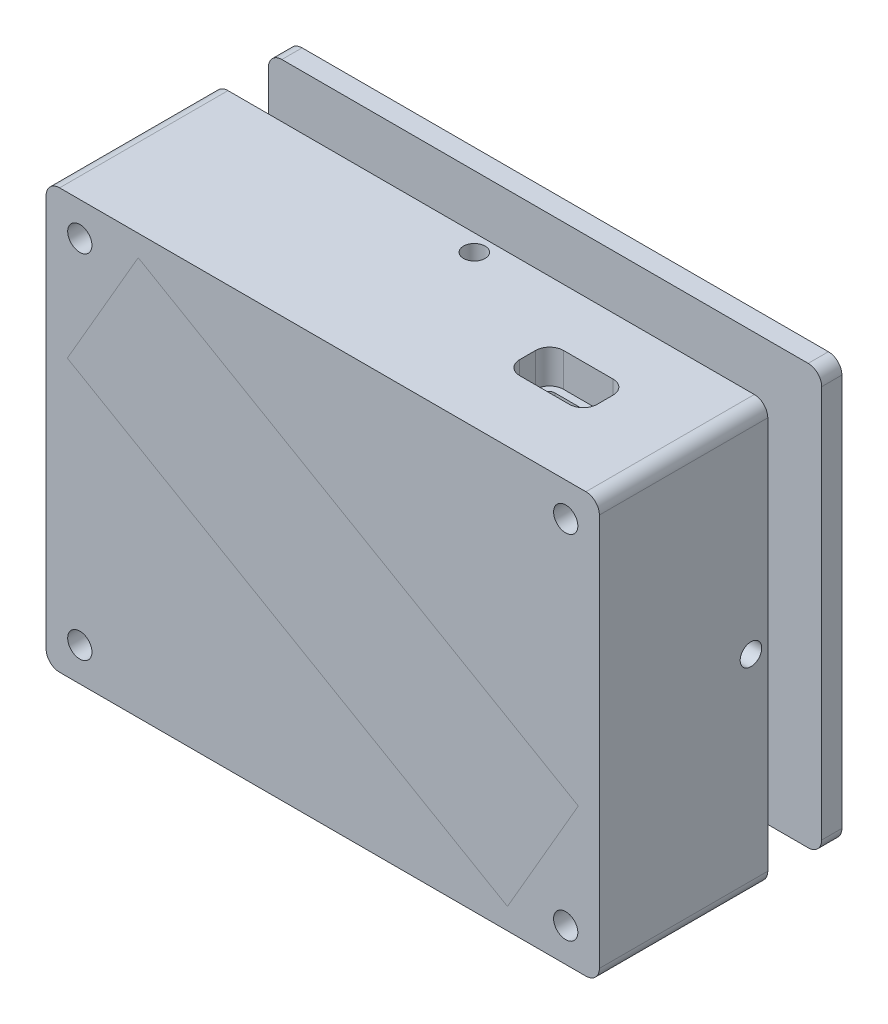
from build123d import *

# Parameters (mm, degrees)
SKETCH1_W                = 70
SKETCH1_H                = 50
BOSS_EXTRUDE1_DEPTH      = 2
BOSS_EXTRUDE2_DEPTH      = 21
EXTRUDE_THIN1_DEPTH      = 10
EXTRUDE_THIN1_DEPTH_BACK = 23
SKETCH3_W                = 82.141201594
SKETCH3_H                = 62.29
SKETCH3_W_2              = 76.141201594
SKETCH3_H_2              = 56.29
SKETCH4_W                = 76.141201594
SKETCH4_H                = 56.29
BOSS_EXTRUDE3_DEPTH      = 6
FILLET1_R                = 2
BOSS_EXTRUDE4_DEPTH      = 3
BOSS_EXTRUDE8_DEPTH      = 10
CUT_EXTRUDE1_DEPTH       = 8
CUT_EXTRUDE2_DEPTH       = 8
EXTRUDE_THIN2_DEPTH      = 6
BOSS_EXTRUDE9_START      = 2
BOSS_EXTRUDE9_DEPTH      = 1
FILLET2_R                = 3
SKETCH11_R               = 1.8
CUT_EXTRUDE3_DEPTH       = 5
CUT_EXTRUDE4_DEPTH       = 88.160559078
CUT_EXTRUDE4_DEPTH_BACK  = 88.160559078
SKETCH12_R               = 1.6
CUT_EXTRUDE5_DEPTH       = 92.040453046
CUT_EXTRUDE5_DEPTH_BACK  = 92.040453046
SKETCH13_R               = 1.6


with BuildPart() as part:
    # Sketch1 → Boss-Extrude1 (new body)
    with BuildSketch(Plane.XY):
        with Locations((-17.311659193, -1.674887892)):
            Rectangle(SKETCH1_W, SKETCH1_H)
    extrude(amount=BOSS_EXTRUDE1_DEPTH)

    # Sketch2 → Boss-Extrude2 (add)
    with BuildSketch(Plane.XY.offset(2)):
        Polygon((-42.790623702, 27.325112108), (-53.311659193, 9.150739706), (12.029536823, -28.674887892), (22.550572314, -10.500515491), align=None)
    extrude(amount=BOSS_EXTRUDE2_DEPTH)


with BuildPart() as body_2:
    # Sketch3 → Extrude-Thin1 (new, two sides: drawn at the far end of the back side and taken through both)
    with BuildSketch(Plane(origin=(0, 0, 0), x_dir=(-1, 0, 0), z_dir=(0, 0, -1)).offset(-EXTRUDE_THIN1_DEPTH_BACK)):
        with Locations((15.391058396, -0.669887892)):
            Rectangle(SKETCH3_W, SKETCH3_H)
        with Locations((15.391058396, -0.669887892)):
            Rectangle(SKETCH3_W_2, SKETCH3_H_2, mode=Mode.SUBTRACT)
    extrude(amount=EXTRUDE_THIN1_DEPTH + EXTRUDE_THIN1_DEPTH_BACK)

    # Sketch4 → Boss-Extrude3 (add)
    with BuildSketch(Plane.XY.offset(23)):
        with Locations((-15.391058396, -0.669887892)):
            Rectangle(SKETCH4_W, SKETCH4_H)
        Polygon((-42.790623702, 27.325112108), (-53.311659193, 9.150739706), (12.029536823, -28.674887892), (22.550572314, -10.500515491), align=None, mode=Mode.SUBTRACT)
    extrude(amount=-BOSS_EXTRUDE3_DEPTH)

    # Fillet1
    fillet1_edges = [body_2.edges().sort_by_distance(p)[0] for p in [
        (-56.461659193, 30.475112108, 6.5),
        (-56.461659193, -31.814887892, 6.5),
        (25.679542401, -31.814887892, 6.5),
        (25.679542401, 30.475112108, 6.5),
    ]]
    fillet(fillet1_edges, radius=FILLET1_R)

    # Sketch6 → Boss-Extrude8 (add)
    with BuildSketch(Plane(origin=(0, 0, 17), x_dir=(-1, 0, 0), z_dir=(0, 0, -1))):
        Polygon((-16.679542401, 27.475112108), (-22.679542401, 22.532519231), (-22.679542401, 27.475112108), align=None)
        Polygon((42.790623702, 27.325112108), (53.311659193, 9.150739706), (53.461659193, 27.475112108), (42.790623702, 27.475112108), align=None)
        Polygon((-12.029536823, -28.674887892), (-22.550572314, -10.500515491), (-22.679542401, -10.500515491), (-22.679542401, -28.814887892), (53.461659193, -28.814887892), (53.461659193, -25.814887892), (-7.089081569, -25.814887892), align=None)
    extrude(amount=BOSS_EXTRUDE8_DEPTH)

    # Sketch7 → Cut-Extrude1 (cut)
    with BuildSketch(Plane(origin=(0, 0, -10), x_dir=(-1, 0, 0), z_dir=(0, 0, -1))):
        Polygon((-28.614884021, 33.287753378), (-28.614884021, -37.390774311), (75.821884566, -37.390774311), (71.624058107, 45.166479381), align=None)
    extrude(amount=-CUT_EXTRUDE1_DEPTH, mode=Mode.SUBTRACT)

    # Sketch8 → Cut-Extrude2 (cut)
    with BuildSketch(Plane(origin=(0, 30.475112108, 0), x_dir=(1, 0, 0), z_dir=(0, 1, 0))):
        with BuildLine():
            Line((1.779542401, -8.574068331), (1.779542401, -10.925931669))
            ThreePointArc((1.779542401, -10.925931669), (2.38702295, -12.392519451), (3.853610732, -13))
            Line((3.853610732, -13), (11.20547407, -13))
            ThreePointArc((11.20547407, -13), (12.672061852, -12.392519451), (13.279542401, -10.925931669))
            Line((13.279542401, -10.925931669), (13.279542401, -8.574068331))
            ThreePointArc((13.279542401, -8.574068331), (12.672061852, -7.107480549), (11.20547407, -6.5))
            Line((11.20547407, -6.5), (3.853610732, -6.5))
            ThreePointArc((3.853610732, -6.5), (2.38702295, -7.107480549), (1.779542401, -8.574068331))
        make_face()
    extrude(amount=-CUT_EXTRUDE2_DEPTH, mode=Mode.SUBTRACT)

    # Sketch8<2> → Extrude-Thin2 (add)
    with BuildSketch(Plane(origin=(0, 30.475112108, 0), x_dir=(1, 0, 0), z_dir=(0, 1, 0))):
        with BuildLine():
            Line((-0.220457599, -8.574068331), (-0.220457599, -10.925931669))
            ThreePointArc((-0.220457599, -10.925931669), (0.972809388, -13.806733013), (3.853610732, -15))
            Line((3.853610732, -15), (11.20547407, -15))
            ThreePointArc((11.20547407, -15), (14.086275414, -13.806733013), (15.279542401, -10.925931669))
            Line((15.279542401, -10.925931669), (15.279542401, -8.574068331))
            ThreePointArc((15.279542401, -8.574068331), (14.086275414, -5.693266987), (11.20547407, -4.5))
            Line((11.20547407, -4.5), (3.853610732, -4.5))
            ThreePointArc((3.853610732, -4.5), (0.972809388, -5.693266987), (-0.220457599, -8.574068331))
        make_face()
        with BuildLine():
            Line((1.779542401, -8.574068331), (1.779542401, -10.925931669))
            ThreePointArc((1.779542401, -10.925931669), (2.38702295, -12.392519451), (3.853610732, -13))
            Line((3.853610732, -13), (11.20547407, -13))
            ThreePointArc((11.20547407, -13), (12.672061852, -12.392519451), (13.279542401, -10.925931669))
            Line((13.279542401, -10.925931669), (13.279542401, -8.574068331))
            ThreePointArc((13.279542401, -8.574068331), (12.672061852, -7.107480549), (11.20547407, -6.5))
            Line((11.20547407, -6.5), (3.853610732, -6.5))
            ThreePointArc((3.853610732, -6.5), (2.38702295, -7.107480549), (1.779542401, -8.574068331))
        make_face(mode=Mode.SUBTRACT)
    extrude(amount=-EXTRUDE_THIN2_DEPTH)

    # Sketch10 → Boss-Extrude9 (add)
    with BuildSketch(Plane.XZ.offset(-27.475112108).offset(BOSS_EXTRUDE9_START)):
        with BuildLine():
            Line((1.779542401, 8.574068331), (1.779542401, 10.925931669))
            ThreePointArc((1.779542401, 10.925931669), (2.38702295, 12.392519451), (3.853610732, 13))
            Line((3.853610732, 13), (11.20547407, 13))
            ThreePointArc((11.20547407, 13), (12.672061852, 12.392519451), (13.279542401, 10.925931669))
            Line((13.279542401, 10.925931669), (13.279542401, 8.574068331))
            ThreePointArc((13.279542401, 8.574068331), (12.672061852, 7.107480549), (11.20547407, 6.5))
            Line((11.20547407, 6.5), (3.853610732, 6.5))
            ThreePointArc((3.853610732, 6.5), (2.38702295, 7.107480549), (1.779542401, 8.574068331))
        make_face()
        with BuildLine():
            Line((3.679542401, 11.9), (11.379542401, 11.9))
            ThreePointArc((11.379542401, 11.9), (12.086649182, 11.607106781), (12.379542401, 10.9))
            Line((12.379542401, 10.9), (12.379542401, 8.6))
            ThreePointArc((12.379542401, 8.6), (12.086649182, 7.892893219), (11.379542401, 7.6))
            Line((11.379542401, 7.6), (3.679542401, 7.6))
            ThreePointArc((3.679542401, 7.6), (2.97243562, 7.892893219), (2.679542401, 8.6))
            Line((2.679542401, 8.6), (2.679542401, 10.9))
            ThreePointArc((2.679542401, 10.9), (2.97243562, 11.607106781), (3.679542401, 11.9))
        make_face(mode=Mode.SUBTRACT)
    extrude(amount=BOSS_EXTRUDE9_DEPTH)

    # Fillet2
    # the kernel refuses this fillet: 3 mm, written as the material it takes off along each edge
    with BuildSketch(Plane(origin=(3.853610732, 24.475112108, 15), x_dir=(0, 1, 0), z_dir=(1, 0, 0)), Plane(origin=(11.20547407, 24.475112108, 4.5), x_dir=(0, 1, 0), z_dir=(-1, 0, 0))) as fillet2_piece_1:
        with BuildLine():
            CenterArc((FILLET2_R, -FILLET2_R), FILLET2_R, 90, 90)
            Line((0, -FILLET2_R), (0, 0))
            Line((0, 0), (FILLET2_R, 0))
        make_face()
    extrude(amount=7.351863339, mode=Mode.SUBTRACT)
    with BuildSketch(Plane(origin=(11.20547407, 24.475112108, 10.925931669), x_dir=(0, 0, 1), z_dir=(-1, 0, 0))) as fillet2_piece_2:
        with BuildLine():
            CenterArc((4.074068331 - FILLET2_R, FILLET2_R), FILLET2_R, 270, 90)
            Line((4.074068331 - FILLET2_R, 0), (4.074068331, 0))
            Line((4.074068331, 0), (4.074068331, FILLET2_R))
        make_face()
    revolve(axis=Axis((11.20547407, 24.475112108, 10.925931669), (0, 1, 0)), revolution_arc=90, mode=Mode.SUBTRACT)
    with BuildSketch(Plane(origin=(11.20547407, 24.475112108, 8.574068331), x_dir=(1, 0, 0), z_dir=(0, 0, 1))) as fillet2_piece_3:
        with BuildLine():
            CenterArc((4.074068331 - FILLET2_R, FILLET2_R), FILLET2_R, 270, 90)
            Line((4.074068331 - FILLET2_R, 0), (4.074068331, 0))
            Line((4.074068331, 0), (4.074068331, FILLET2_R))
        make_face()
    revolve(axis=Axis((11.20547407, 24.475112108, 8.574068331), (0, 1, 0)), revolution_arc=90, mode=Mode.SUBTRACT)
    with BuildSketch(Plane(origin=(3.853610732, 24.475112108, 8.574068331), x_dir=(0, 0, -1), z_dir=(1, 0, 0))) as fillet2_piece_4:
        with BuildLine():
            CenterArc((4.074068331 - FILLET2_R, FILLET2_R), FILLET2_R, 270, 90)
            Line((4.074068331 - FILLET2_R, 0), (4.074068331, 0))
            Line((4.074068331, 0), (4.074068331, FILLET2_R))
        make_face()
    revolve(axis=Axis((3.853610732, 24.475112108, 8.574068331), (0, 1, 0)), revolution_arc=90, mode=Mode.SUBTRACT)
    with BuildSketch(Plane(origin=(3.853610732, 24.475112108, 10.925931669), x_dir=(-1, 0, 0), z_dir=(0, 0, -1))) as fillet2_piece_5:
        with BuildLine():
            CenterArc((4.074068331 - FILLET2_R, FILLET2_R), FILLET2_R, 270, 90)
            Line((4.074068331 - FILLET2_R, 0), (4.074068331, 0))
            Line((4.074068331, 0), (4.074068331, FILLET2_R))
        make_face()
    revolve(axis=Axis((3.853610732, 24.475112108, 10.925931669), (0, 1, 0)), revolution_arc=90, mode=Mode.SUBTRACT)
    with BuildSketch(Plane(origin=(-0.220457599, 24.475112108, 8.574068331), x_dir=(0, 1, 0), z_dir=(0, 0, 1)), Plane(origin=(15.279542401, 24.475112108, 10.925931669), x_dir=(0, 1, 0), z_dir=(0, 0, -1))) as fillet2_piece_6:
        with BuildLine():
            CenterArc((FILLET2_R, -FILLET2_R), FILLET2_R, 90, 90)
            Line((0, -FILLET2_R), (0, 0))
            Line((0, 0), (FILLET2_R, 0))
        make_face()
    extrude(amount=2.351863339, mode=Mode.SUBTRACT)

    # Sketch11 → Cut-Extrude3 (cut)
    with BuildSketch(Plane.XY.offset(23)):
        with Locations((-51.461659193, 25.475112108)):
            Circle(SKETCH11_R)
        with Locations(Location((-51.461659193, -26.814887892, 0), (0, 0, 180))):
            Circle(SKETCH11_R)
        with Locations((20.679542401, -26.814887892)):
            Circle(SKETCH11_R)
        with Locations(Location((20.679542401, 25.475112108, 0), (0, 0, 180))):
            Circle(SKETCH11_R)
    extrude(amount=-CUT_EXTRUDE3_DEPTH, mode=Mode.SUBTRACT)

    # Sketch12 → Cut-Extrude4 (cut, two sides: drawn at the far end of the back side and taken through both)
    with BuildSketch(Plane(origin=(0, 30.475112108, 0), x_dir=(1, 0, 0), z_dir=(0, 1, 0)).offset(-CUT_EXTRUDE4_DEPTH_BACK)):
        with Locations(Location((-15.391058396, -0.5, 0), (0, 0, 180))):
            Circle(SKETCH12_R)
    extrude(amount=CUT_EXTRUDE4_DEPTH + CUT_EXTRUDE4_DEPTH_BACK, mode=Mode.SUBTRACT)

    # Sketch13 → Cut-Extrude5 (cut, two sides: drawn at the far end of the back side and taken through both)
    with BuildSketch(Plane(origin=(25.679542401, 0, 0), x_dir=(0, 0, -1), z_dir=(1, 0, 0)).offset(-CUT_EXTRUDE5_DEPTH_BACK)):
        with Locations(Location((-0.5, -0.669887892, 0), (0, 0, 90))):
            Circle(SKETCH13_R)
    extrude(amount=CUT_EXTRUDE5_DEPTH + CUT_EXTRUDE5_DEPTH_BACK, mode=Mode.SUBTRACT)


with BuildPart() as body_3:
    # Sketch5 → Boss-Extrude4 (new body)
    with BuildSketch(Plane(origin=(0, 0, -10), x_dir=(-1, 0, 0), z_dir=(0, 0, -1))):
        with BuildLine():
            Line((-25.679542401, 28.475112108), (-25.679542401, -29.814887892))
            ThreePointArc((-25.679542401, -29.814887892), (-25.093755963, -31.229101455), (-23.679542401, -31.814887892))
            Line((-23.679542401, -31.814887892), (54.461659193, -31.814887892))
            ThreePointArc((54.461659193, -31.814887892), (55.875872755, -31.229101455), (56.461659193, -29.814887892))
            Line((56.461659193, -29.814887892), (56.461659193, 28.475112108))
            ThreePointArc((56.461659193, 28.475112108), (55.875872755, 29.88932567), (54.461659193, 30.475112108))
            Line((54.461659193, 30.475112108), (-23.679542401, 30.475112108))
            ThreePointArc((-23.679542401, 30.475112108), (-25.093755963, 29.88932567), (-25.679542401, 28.475112108))
        make_face()
    extrude(amount=BOSS_EXTRUDE4_DEPTH)


solid = Compound([part.part, body_2.part, body_3.part])
